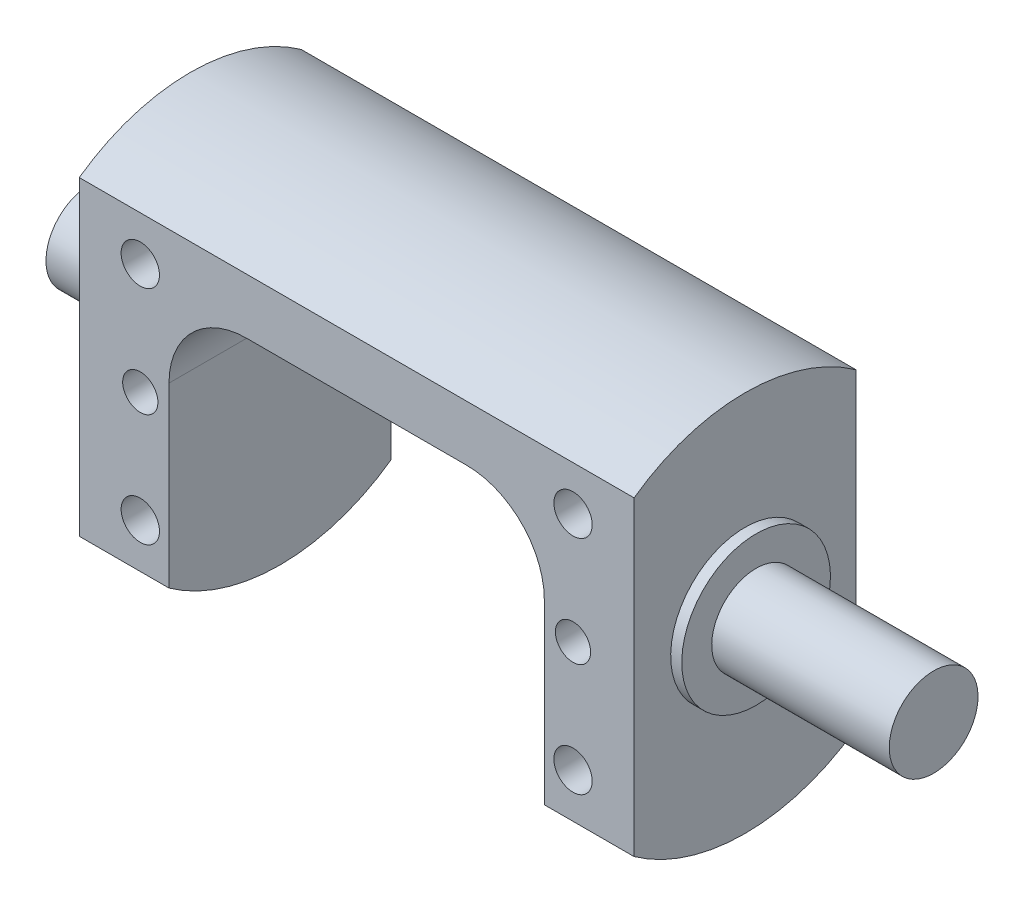
from build123d import *

# Parameters (mm, degrees)
CUT_EXTRUDE1_DEPTH                  = 72.281133549
CUT_EXTRUDE1_DEPTH_BACK             = 72.281133549
SKETCH3_OUTSIDE_W                   = 54.458
SKETCH3_OUTSIDE_H                   = 54.458
SKETCH3_OUTSIDE_W_2                 = 20
SKETCH3_OUTSIDE_H_2                 = 34.409301068
F_8_32_TAPPED_HOLE1_AT_2_COUNT      = 2
F_8_32_TAPPED_HOLE1_AT_2_PITCH      = 43.829214002
F_8_32_TAPPED_HOLE1_AT_3_COUNT      = 2
F_8_32_TAPPED_HOLE1_AT_3_PITCH      = 20
F_8_32_TAPPED_HOLE1_AT_4_COUNT      = 2
F_8_32_TAPPED_HOLE1_AT_4_PITCH      = 39
F_1_8_0_1250_DOWEL_HOLE1_AT_2_COUNT = 2
F_1_8_0_1250_DOWEL_HOLE1_AT_2_PITCH = 39
F_8_32_TAPPED_HOLE2_D               = 3.4544
F_8_32_TAPPED_HOLE2_DEPTH           = 10.71
F_8_32_TAPPED_HOLE2_TIP             = 1.037806461
CUT_EXTRUDE3_DEPTH                  = 50.598387071
CUT_EXTRUDE3_DEPTH_BACK             = 50.598387071


with BuildPart() as part:
    # Sketch2 → Revolve1 (revolve)
    with BuildSketch(Plane.XY):
        Polygon((-34, 0), (42, 0), (42, 4), (26, 4), (26, 6.7), (25, 6.7), (25, 17.204650534), (-25, 17.204650534), (-25, 6.7), (-27.5, 6.7), (-27.5, 4), (-34, 4), align=None)
    revolve(axis=Axis((-34, 0, 0), (1, 0, 0)))

    # Sketch3 outside → Cut-Extrude1 (cut, two sides: drawn at the far end of the back side and taken through both)
    with BuildSketch(Plane.ZY.offset(25).offset(-CUT_EXTRUDE1_DEPTH_BACK)):
        Rectangle(SKETCH3_OUTSIDE_W, SKETCH3_OUTSIDE_H)
        Rectangle(SKETCH3_OUTSIDE_W_2, SKETCH3_OUTSIDE_H_2, mode=Mode.SUBTRACT)
    extrude(amount=CUT_EXTRUDE1_DEPTH + CUT_EXTRUDE1_DEPTH_BACK, mode=Mode.SUBTRACT)

    # Sketch5 → #8-32 Tapped Hole1 (revolve, cut)
    with BuildSketch(Plane(origin=(19.5, 10, -10), x_dir=(0, 1, 0), z_dir=(1, 0, 0))):
        Polygon((0, 0), (0, 11.747806461), (1.7272, 10.71), (1.7272, 0), align=None)
    f_8_32_tapped_hole1 = revolve(axis=Axis((19.5, 10, -16.35), (0, 0, 1)), mode=Mode.SUBTRACT)

    # #8-32 Tapped Hole1 at 2: #8-32 Tapped Hole1 ×2
    with Locations(*[Vector(-0.889817462812737, -0.4563166475962754, 0) * (i * F_8_32_TAPPED_HOLE1_AT_2_PITCH) for i in range(1, F_8_32_TAPPED_HOLE1_AT_2_COUNT)]):
        add(f_8_32_tapped_hole1, mode=Mode.SUBTRACT)

    # #8-32 Tapped Hole1 at 3: #8-32 Tapped Hole1 ×2
    with Locations(*[(0, -i * F_8_32_TAPPED_HOLE1_AT_3_PITCH, 0) for i in range(1, F_8_32_TAPPED_HOLE1_AT_3_COUNT)]):
        add(f_8_32_tapped_hole1, mode=Mode.SUBTRACT)

    # #8-32 Tapped Hole1 at 4: #8-32 Tapped Hole1 ×2
    with Locations(*[(-i * F_8_32_TAPPED_HOLE1_AT_4_PITCH, 0, 0) for i in range(1, F_8_32_TAPPED_HOLE1_AT_4_COUNT)]):
        add(f_8_32_tapped_hole1, mode=Mode.SUBTRACT)

    # Sketch7 → 1/8 (0.1250) Dowel Hole1 (revolve, cut)
    with BuildSketch(Plane(origin=(19.5, 0, -10), x_dir=(0, 1, 0), z_dir=(1, 0, 0))):
        Polygon((0, 0), (0, 6.953866233), (1.5875, 6), (1.5875, 0), align=None)
    f_1_8_0_1250_dowel_hole1 = revolve(axis=Axis((19.5, 0, -16.35), (0, 0, 1)), mode=Mode.SUBTRACT)

    # 1/8 (0.1250) Dowel Hole1 at 2: 1/8 (0.1250) Dowel Hole1 ×2
    with Locations(*[(-i * F_1_8_0_1250_DOWEL_HOLE1_AT_2_PITCH, 0, 0) for i in range(1, F_1_8_0_1250_DOWEL_HOLE1_AT_2_COUNT)]):
        add(f_1_8_0_1250_dowel_hole1, mode=Mode.SUBTRACT)

    # Mirror1: #8-32 Tapped Hole1, 1/8 (0.1250) Dowel Hole1 across plane
    add(f_8_32_tapped_hole1.mirror(Plane.XY), mode=Mode.SUBTRACT)
    add(f_1_8_0_1250_dowel_hole1.mirror(Plane.XY), mode=Mode.SUBTRACT)

    # Mirror1 copy 1 sketch → Mirror1 copy 1 (revolve, cut)
    with BuildSketch(Plane(origin=(-19.5, -10, 10), x_dir=(0, 1, 0), z_dir=(1, 0, 0))):
        Polygon((0, 0), (0, -11.747806461), (1.7272, -10.71), (1.7272, 0), align=None)
    revolve(axis=Axis((-19.5, -10, 16.35), (0, 0, 1)), mode=Mode.SUBTRACT)

    # Mirror1 copy 2 sketch → Mirror1 copy 2 (revolve, cut)
    with BuildSketch(Plane(origin=(19.5, -10, 10), x_dir=(0, 1, 0), z_dir=(1, 0, 0))):
        Polygon((0, 0), (0, -11.747806461), (1.7272, -10.71), (1.7272, 0), align=None)
    revolve(axis=Axis((19.5, -10, 16.35), (0, 0, 1)), mode=Mode.SUBTRACT)

    # Mirror1 copy 3 sketch → Mirror1 copy 3 (revolve, cut)
    with BuildSketch(Plane(origin=(-19.5, 10, 10), x_dir=(0, 1, 0), z_dir=(1, 0, 0))):
        Polygon((0, 0), (0, -11.747806461), (1.7272, -10.71), (1.7272, 0), align=None)
    revolve(axis=Axis((-19.5, 10, 16.35), (0, 0, 1)), mode=Mode.SUBTRACT)

    # Mirror1 copy 4 sketch → Mirror1 copy 4 (revolve, cut)
    with BuildSketch(Plane(origin=(-19.5, 0, 10), x_dir=(0, 1, 0), z_dir=(1, 0, 0))):
        Polygon((0, 0), (0, -6.953866233), (1.5875, -6), (1.5875, 0), align=None)
    revolve(axis=Axis((-19.5, 0, 16.35), (0, 0, 1)), mode=Mode.SUBTRACT)

    # #8-32 Tapped Hole2
    with Locations(Plane.ZY.offset(34)):
        with Locations((0, 0)):
            Hole(F_8_32_TAPPED_HOLE2_D / 2, depth=F_8_32_TAPPED_HOLE2_DEPTH)
            with Locations((0, 0, -(F_8_32_TAPPED_HOLE2_DEPTH + F_8_32_TAPPED_HOLE2_TIP / 2))):  # 118° drill point
                Cone(0, F_8_32_TAPPED_HOLE2_D / 2, F_8_32_TAPPED_HOLE2_TIP, mode=Mode.SUBTRACT)

    # Sketch12 → Cut-Extrude3 (cut, two sides: drawn at the far end of the back side and taken through both)
    with BuildSketch(Plane.XY.offset(10).offset(-CUT_EXTRUDE3_DEPTH_BACK)):
        with BuildLine():
            Line((-9.9125, -37.391646785), (9.9125, -37.391646785))
            ThreePointArc((9.9125, -37.391646785), (14.862247468, -35.341394253), (16.9125, -30.391646785))
            Line((16.9125, -30.391646785), (16.9125, 2))
            ThreePointArc((16.9125, 2), (14.862247468, 6.949747468), (9.9125, 9))
            Line((9.9125, 9), (-9.9125, 9))
            ThreePointArc((-9.9125, 9), (-14.862247468, 6.949747468), (-16.9125, 2))
            Line((-16.9125, 2), (-16.9125, -30.391646785))
            ThreePointArc((-16.9125, -30.391646785), (-14.862247468, -35.341394253), (-9.9125, -37.391646785))
        make_face()
    extrude(amount=CUT_EXTRUDE3_DEPTH + CUT_EXTRUDE3_DEPTH_BACK, mode=Mode.SUBTRACT)


solid = part.part
